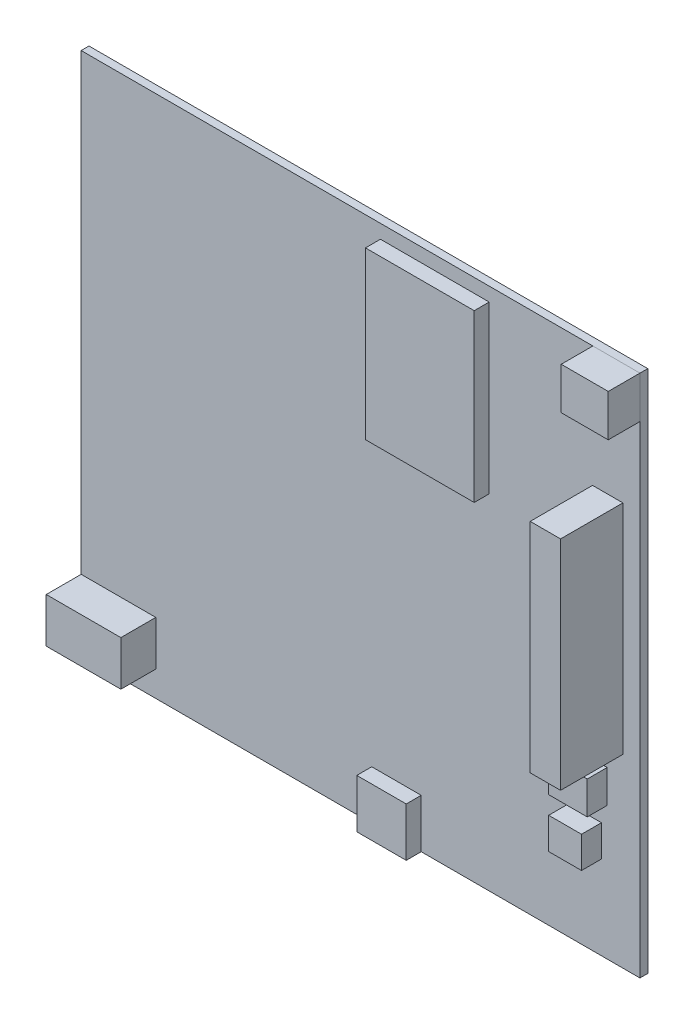
from build123d import *

# Parameters (mm, degrees)
SKETCH1_W             = 112
SKETCH1_H             = 105
BASE_PCB_DEPTH        = 1.57
SMA_START             = 1.57
SKETCH1_3_W           = 9.425761926
SKETCH1_3_H           = 8.407839617
SMA_CONNECTOR_DEPTH   = 6.35
MINI_START            = 1.57
SKETCH1_4_W           = 9.91153772
SKETCH1_4_H           = 9.792921807
MINI_USB_DEPTH        = 3
BARREL_START          = 1.57
SKETCH1_5_W           = 14.958155809
SKETCH1_5_H           = 8.968458872
BARREL_JACK_DEPTH     = 7
GPIO_START            = 1.57
SKETCH1_6_W           = 6.081801239
SKETCH1_6_H           = 43.650976509
GPIO_DEPTH            = 12.5
BUTTONS_START         = 1.57
SKETCH1_7_W           = 7.730121667
SKETCH1_7_H           = 6.584918457
BUTTONS_DEPTH         = 4
SKETCH1_7_W_2         = 6.584918457
SKETCH1_7_H_2         = 6.298617654
BUTTONS_2_DEPTH       = 4
XBEE_START            = 1.57
SKETCH1_8_W           = 21.798337537
SKETCH1_8_H           = 33.296361733
XBEE_DEPTH            = 3
SKETCH2_R             = 5
BOSS_EXTRUDE8_DEPTH   = 3
BOSS_EXTRUDE8_2_DEPTH = 3
BOSS_EXTRUDE8_3_DEPTH = 3
BOSS_EXTRUDE8_4_DEPTH = 3
FILLET1_SIZE          = 1
FILLET1_SIZE_2        = 3
FILLET2_SIZE          = 1
FILLET2_SIZE_2        = 3
FILLET3_SIZE          = 1
FILLET3_SIZE_2        = 3
FILLET4_SIZE          = 1
FILLET4_SIZE_2        = 3


with BuildPart() as part:
    # Sketch1 → Base PCB (new body)
    with BuildSketch(Plane.XY):
        with Locations((56, 52.5)):
            Rectangle(SKETCH1_W, SKETCH1_H)
    extrude(amount=BASE_PCB_DEPTH)


with BuildPart() as body_2:
    # Sketch1<3> → SMA Connector (new body)
    with BuildSketch(Plane.XY.offset(SMA_START)):
        with Locations((107.287119037, 100.796080192)):
            Rectangle(SKETCH1_3_W, SKETCH1_3_H)
    extrude(amount=SMA_CONNECTOR_DEPTH)


with BuildPart() as body_3:
    # Sketch1<4> → Mini USB (new body)
    with BuildSketch(Plane.XY.offset(MINI_START)):
        with Locations((63.202795022, 4.896460904)):
            Rectangle(SKETCH1_4_W, SKETCH1_4_H)
    extrude(amount=MINI_USB_DEPTH)


with BuildPart() as body_4:
    # Sketch1<5> → Barrel Jack (new body)
    with BuildSketch(Plane.XY.offset(BARREL_START)):
        with Locations((7.479077905, 9.58918666)):
            Rectangle(SKETCH1_5_W, SKETCH1_5_H)
    extrude(amount=BARREL_JACK_DEPTH)


with BuildPart() as body_5:
    # Sketch1<6> → GPIO (new body)
    with BuildSketch(Plane.XY.offset(GPIO_START)):
        with Locations((105.547707115, 58.942048646)):
            Rectangle(SKETCH1_6_W, SKETCH1_6_H)
    extrude(amount=GPIO_DEPTH)


with BuildPart() as body_6:
    # Sketch1<7> → Buttons (new body)
    with BuildSketch(Plane.XY.offset(BUTTONS_START)):
        with Locations((101.574238073, 29.972941445)):
            Rectangle(SKETCH1_7_W, SKETCH1_7_H)
    extrude(amount=BUTTONS_DEPTH)


with BuildPart() as body_7:
    # Sketch1<7> → Buttons 2 (new body)
    with BuildSketch(Plane.XY.offset(BUTTONS_START)):
        with Locations((101.001636469, 19.952413358)):
            Rectangle(SKETCH1_7_W_2, SKETCH1_7_H_2)
    extrude(amount=BUTTONS_2_DEPTH)


with BuildPart() as body_8:
    # Sketch1<8> → Xbee (new body)
    with BuildSketch(Plane.XY.offset(XBEE_START)):
        with Locations((70.886461835, 85.586335751)):
            Rectangle(SKETCH1_8_W, SKETCH1_8_H)
    extrude(amount=XBEE_DEPTH)


with BuildPart() as body_9:
    # Sketch2 → Boss-Extrude8 (new body)
    with BuildSketch(Plane(origin=(0, 0, 0), x_dir=(-1, 0, 0), z_dir=(0, 0, -1))):
        with Locations(Location((-99.3, 92.3, 0), (0, 0, 180))):
            Circle(SKETCH2_R)
    extrude(amount=BOSS_EXTRUDE8_DEPTH)

    # Fillet1
    # an asymmetric fillet: 3, 1 mm, written as the material it takes off along each edge
    with BuildSketch(Plane(origin=(99.3, 92.3, -3), x_dir=(1, 0, 0), z_dir=(0, 1, 0))) as fillet1_piece_1:
        with BuildLine():
            Bezier((5, -FILLET1_SIZE), (5, 0), (5 - FILLET1_SIZE_2, 0), weights=[1, 0.707106781, 1])
            Line((5 - FILLET1_SIZE_2, 0), (5, 0))
            Line((5, 0), (5, -FILLET1_SIZE))
        make_face()
    revolve(axis=Axis((99.3, 92.3, -3), (0, 0, -1)), mode=Mode.SUBTRACT)


with BuildPart() as body_10:
    # Sketch2 → Boss-Extrude8 2 (new body)
    with BuildSketch(Plane(origin=(0, 0, 0), x_dir=(-1, 0, 0), z_dir=(0, 0, -1))):
        with Locations(Location((-12.7, 92.3, 0), (0, 0, 180))):
            Circle(SKETCH2_R)
    extrude(amount=BOSS_EXTRUDE8_2_DEPTH)

    # Fillet3
    # an asymmetric fillet: 3, 1 mm, written as the material it takes off along each edge
    with BuildSketch(Plane(origin=(12.7, 92.3, -3), x_dir=(1, 0, 0), z_dir=(0, 1, 0))) as fillet3_piece_1:
        with BuildLine():
            Bezier((5, -FILLET3_SIZE), (5, 0), (5 - FILLET3_SIZE_2, 0), weights=[1, 0.707106781, 1])
            Line((5 - FILLET3_SIZE_2, 0), (5, 0))
            Line((5, 0), (5, -FILLET3_SIZE))
        make_face()
    revolve(axis=Axis((12.7, 92.3, -3), (0, 0, -1)), mode=Mode.SUBTRACT)


with BuildPart() as body_11:
    # Sketch2 → Boss-Extrude8 3 (new body)
    with BuildSketch(Plane(origin=(0, 0, 0), x_dir=(-1, 0, 0), z_dir=(0, 0, -1))):
        with Locations(Location((-99.3, 12.347488339, 0), (0, 0, 180))):
            Circle(SKETCH2_R)
    extrude(amount=BOSS_EXTRUDE8_3_DEPTH)

    # Fillet2
    # an asymmetric fillet: 3, 1 mm, written as the material it takes off along each edge
    with BuildSketch(Plane(origin=(99.3, 12.347488339, -3), x_dir=(1, 0, 0), z_dir=(0, 1, 0))) as fillet2_piece_1:
        with BuildLine():
            Bezier((5, -FILLET2_SIZE), (5, 0), (5 - FILLET2_SIZE_2, 0), weights=[1, 0.707106781, 1])
            Line((5 - FILLET2_SIZE_2, 0), (5, 0))
            Line((5, 0), (5, -FILLET2_SIZE))
        make_face()
    revolve(axis=Axis((99.3, 12.347488339, -3), (0, 0, -1)), mode=Mode.SUBTRACT)


with BuildPart() as body_12:
    # Sketch2 → Boss-Extrude8 4 (new body)
    with BuildSketch(Plane(origin=(0, 0, 0), x_dir=(-1, 0, 0), z_dir=(0, 0, -1))):
        with Locations(Location((-12.7, 12.347488339, 0), (0, 0, 180))):
            Circle(SKETCH2_R)
    extrude(amount=BOSS_EXTRUDE8_4_DEPTH)

    # Fillet4
    # an asymmetric fillet: 3, 1 mm, written as the material it takes off along each edge
    with BuildSketch(Plane(origin=(12.7, 12.347488339, -3), x_dir=(1, 0, 0), z_dir=(0, 1, 0))) as fillet4_piece_1:
        with BuildLine():
            Bezier((5, -FILLET4_SIZE), (5, 0), (5 - FILLET4_SIZE_2, 0), weights=[1, 0.707106781, 1])
            Line((5 - FILLET4_SIZE_2, 0), (5, 0))
            Line((5, 0), (5, -FILLET4_SIZE))
        make_face()
    revolve(axis=Axis((12.7, 12.347488339, -3), (0, 0, -1)), mode=Mode.SUBTRACT)


solid = Compound([part.part, body_2.part, body_3.part, body_4.part, body_5.part, body_6.part, body_7.part, body_8.part, body_9.part, body_10.part, body_11.part, body_12.part])
